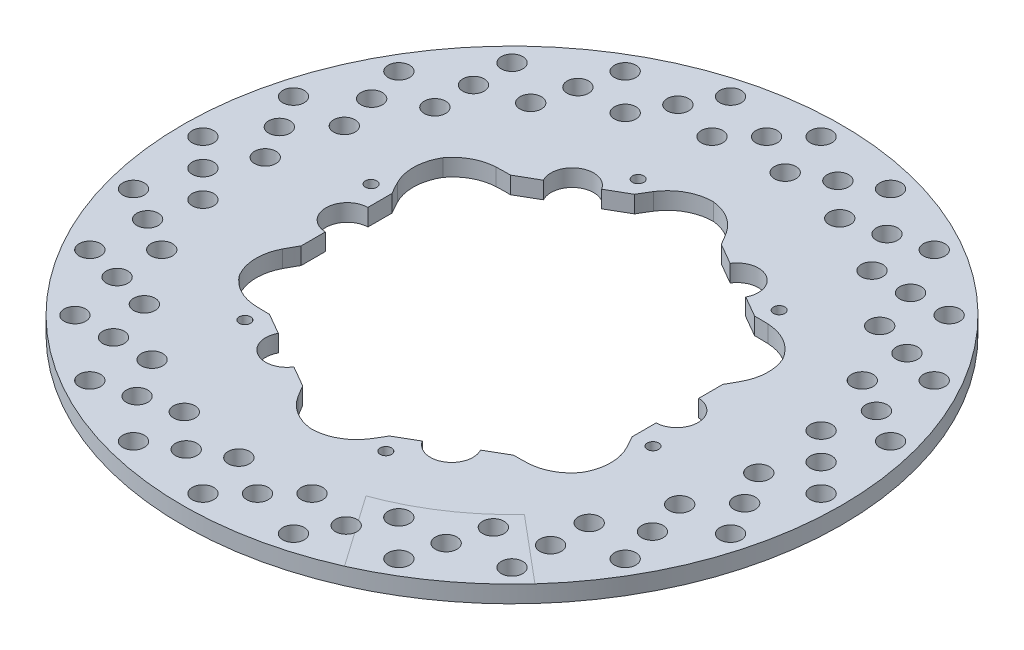
from build123d import *

# Parameters (mm, degrees)
SKETCH1_R                = 92.075
SKETCH1_R_2              = 55.5625
BOSS_EXTRUDE2_DEPTH      = 2.38125
SKETCH2_R                = 3
CUT_EXTRUDE1_DEPTH       = 131.30077765
BOSS_EXTRUDE3_DEPTH      = 2.38125
FILLET1_R                = 12.7
CIRPATTERN1_START        = -2.38125
CIRPATTERN1_DEPTH        = 4.7625
SPEED_SENSOR_HOLE_R      = 1.5875
SPEED_SENSOR_HOLES_DEPTH = 4.7625


# Read off the part's stored shape, not the designer's step: CirPattern1
with BuildPart() as part:
    # Sketch1 → Boss-Extrude2 (new, symmetric)
    with BuildSketch(Plane(origin=(0, 0, 0), x_dir=(1, 0, 0), z_dir=(0, 1, 0))):
        with Locations(Location((0, 0, 0), (0, 0, 90))):
            Circle(SKETCH1_R)
        with Locations(Location((0, 0, 0), (0, 0, 90))):
            Circle(SKETCH1_R_2, mode=Mode.SUBTRACT)
    extrude(amount=BOSS_EXTRUDE2_DEPTH, both=True)

    # Sketch2 → Cut-Extrude1 (cut, through all)
    with BuildSketch(Plane.XZ.offset(2.38125)):
        with Locations(Location((0, 86.36, 0), (0, 0, 270))):
            Circle(SKETCH2_R)
        with Locations(Location((7.62, 78.74, 0), (0, 0, 270))):
            Circle(SKETCH2_R)
        with Locations(Location((15.24, 71.12, 0), (0, 0, 270))):
            Circle(SKETCH2_R)
        with Locations(Location((27.739766408, 74.084798438, 0), (0, 0, 270))):
            Circle(SKETCH2_R)
        with Locations(Location((33.12792008, 64.752242518, 0), (0, 0, 270))):
            Circle(SKETCH2_R)
        with Locations(Location((22.351612735, 83.417354358, 0), (0, 0, 270))):
            Circle(SKETCH2_R)
        with Locations(Location((45.969113577, 64.380840294, 0), (0, 0, 270))):
            Circle(SKETCH2_R)
        with Locations(Location((48.758227154, 53.971726717, 0), (0, 0, 270))):
            Circle(SKETCH2_R)
        with Locations(Location((43.18, 74.789953871, 0), (0, 0, 270))):
            Circle(SKETCH2_R)
        with Locations(Location((61.065741623, 50.289434278, 0), (0, 0, 270))):
            Circle(SKETCH2_R)
        with Locations(Location((61.065741623, 39.513126933, 0), (0, 0, 270))):
            Circle(SKETCH2_R)
        with Locations(Location((61.065741623, 61.065741623, 0), (0, 0, 270))):
            Circle(SKETCH2_R)
        with Locations(Location((72.000840294, 32.770886423, 0), (0, 0, 270))):
            Circle(SKETCH2_R)
        with Locations(Location((69.211726717, 22.361772846, 0), (0, 0, 270))):
            Circle(SKETCH2_R)
        with Locations(Location((74.789953871, 43.18, 0), (0, 0, 270))):
            Circle(SKETCH2_R)
        with Locations(Location((78.029200686, 13.019056815, 0), (0, 0, 270))):
            Circle(SKETCH2_R)
        with Locations(Location((72.641047013, 3.686500895, 0), (0, 0, 270))):
            Circle(SKETCH2_R)
        with Locations(Location((83.417354358, 22.351612735, 0), (0, 0, 270))):
            Circle(SKETCH2_R)
        with Locations(Location((78.74, -7.62, 0), (0, 0, 270))):
            Circle(SKETCH2_R)
        with Locations(Location((71.12, -15.24, 0), (0, 0, 270))):
            Circle(SKETCH2_R)
        with Locations(Location((86.36, 0, 0), (0, 0, 270))):
            Circle(SKETCH2_R)
        with Locations(Location((74.084798438, -27.739766408, 0), (0, 0, 270))):
            Circle(SKETCH2_R)
        with Locations(Location((64.752242518, -33.12792008, 0), (0, 0, 270))):
            Circle(SKETCH2_R)
        with Locations(Location((83.417354358, -22.351612735, 0), (0, 0, 270))):
            Circle(SKETCH2_R)
        with Locations(Location((64.380840294, -45.969113577, 0), (0, 0, 270))):
            Circle(SKETCH2_R)
        with Locations(Location((53.971726717, -48.758227154, 0), (0, 0, 270))):
            Circle(SKETCH2_R)
        with Locations(Location((74.789953871, -43.18, 0), (0, 0, 270))):
            Circle(SKETCH2_R)
        with Locations(Location((50.289434278, -61.065741623, 0), (0, 0, 270))):
            Circle(SKETCH2_R)
        with Locations(Location((39.513126933, -61.065741623, 0), (0, 0, 270))):
            Circle(SKETCH2_R)
        with Locations(Location((61.065741623, -61.065741623, 0), (0, 0, 270))):
            Circle(SKETCH2_R)
        with Locations(Location((32.770886423, -72.000840294, 0), (0, 0, 270))):
            Circle(SKETCH2_R)
        with Locations(Location((22.361772846, -69.211726717, 0), (0, 0, 270))):
            Circle(SKETCH2_R)
        with Locations(Location((43.18, -74.789953871, 0), (0, 0, 270))):
            Circle(SKETCH2_R)
        with Locations(Location((13.019056815, -78.029200686, 0), (0, 0, 270))):
            Circle(SKETCH2_R)
        with Locations(Location((3.686500895, -72.641047013, 0), (0, 0, 270))):
            Circle(SKETCH2_R)
        with Locations(Location((22.351612735, -83.417354358, 0), (0, 0, 270))):
            Circle(SKETCH2_R)
        with Locations(Location((-7.62, -78.74, 0), (0, 0, 270))):
            Circle(SKETCH2_R)
        with Locations(Location((-15.24, -71.12, 0), (0, 0, 270))):
            Circle(SKETCH2_R)
        with Locations(Location((0, -86.36, 0), (0, 0, 270))):
            Circle(SKETCH2_R)
        with Locations(Location((-27.739766408, -74.084798438, 0), (0, 0, 270))):
            Circle(SKETCH2_R)
        with Locations(Location((-33.12792008, -64.752242518, 0), (0, 0, 270))):
            Circle(SKETCH2_R)
        with Locations(Location((-22.351612735, -83.417354358, 0), (0, 0, 270))):
            Circle(SKETCH2_R)
        with Locations(Location((-45.969113577, -64.380840294, 0), (0, 0, 270))):
            Circle(SKETCH2_R)
        with Locations(Location((-48.758227154, -53.971726717, 0), (0, 0, 270))):
            Circle(SKETCH2_R)
        with Locations(Location((-43.18, -74.789953871, 0), (0, 0, 270))):
            Circle(SKETCH2_R)
        with Locations(Location((-61.065741623, -50.289434278, 0), (0, 0, 270))):
            Circle(SKETCH2_R)
        with Locations(Location((-61.065741623, -39.513126933, 0), (0, 0, 270))):
            Circle(SKETCH2_R)
        with Locations(Location((-61.065741623, -61.065741623, 0), (0, 0, 270))):
            Circle(SKETCH2_R)
        with Locations(Location((-72.000840294, -32.770886423, 0), (0, 0, 270))):
            Circle(SKETCH2_R)
        with Locations(Location((-69.211726717, -22.361772846, 0), (0, 0, 270))):
            Circle(SKETCH2_R)
        with Locations(Location((-74.789953871, -43.18, 0), (0, 0, 270))):
            Circle(SKETCH2_R)
        with Locations(Location((-78.029200686, -13.019056815, 0), (0, 0, 270))):
            Circle(SKETCH2_R)
        with Locations(Location((-72.641047013, -3.686500895, 0), (0, 0, 270))):
            Circle(SKETCH2_R)
        with Locations(Location((-83.417354358, -22.351612735, 0), (0, 0, 270))):
            Circle(SKETCH2_R)
        with Locations(Location((-78.74, 7.62, 0), (0, 0, 270))):
            Circle(SKETCH2_R)
        with Locations(Location((-71.12, 15.24, 0), (0, 0, 270))):
            Circle(SKETCH2_R)
        with Locations(Location((-86.36, 0, 0), (0, 0, 270))):
            Circle(SKETCH2_R)
        with Locations(Location((-74.084798438, 27.739766408, 0), (0, 0, 270))):
            Circle(SKETCH2_R)
        with Locations(Location((-64.752242518, 33.12792008, 0), (0, 0, 270))):
            Circle(SKETCH2_R)
        with Locations(Location((-83.417354358, 22.351612735, 0), (0, 0, 270))):
            Circle(SKETCH2_R)
        with Locations(Location((-64.380840294, 45.969113577, 0), (0, 0, 270))):
            Circle(SKETCH2_R)
        with Locations(Location((-53.971726717, 48.758227154, 0), (0, 0, 270))):
            Circle(SKETCH2_R)
        with Locations(Location((-74.789953871, 43.18, 0), (0, 0, 270))):
            Circle(SKETCH2_R)
        with Locations(Location((-50.289434278, 61.065741623, 0), (0, 0, 270))):
            Circle(SKETCH2_R)
        with Locations(Location((-39.513126933, 61.065741623, 0), (0, 0, 270))):
            Circle(SKETCH2_R)
        with Locations(Location((-61.065741623, 61.065741623, 0), (0, 0, 270))):
            Circle(SKETCH2_R)
        with Locations(Location((-32.770886423, 72.000840294, 0), (0, 0, 270))):
            Circle(SKETCH2_R)
        with Locations(Location((-22.361772846, 69.211726717, 0), (0, 0, 270))):
            Circle(SKETCH2_R)
        with Locations(Location((-43.18, 74.789953871, 0), (0, 0, 270))):
            Circle(SKETCH2_R)
        with Locations(Location((-13.019056815, 78.029200686, 0), (0, 0, 270))):
            Circle(SKETCH2_R)
        with Locations(Location((-3.686500895, 72.641047013, 0), (0, 0, 270))):
            Circle(SKETCH2_R)
        with Locations(Location((-22.351612735, 83.417354358, 0), (0, 0, 270))):
            Circle(SKETCH2_R)
    extrude(amount=-CUT_EXTRUDE1_DEPTH, mode=Mode.SUBTRACT)

    # Sketch3 → Boss-Extrude3 (add, symmetric)
    with BuildSketch(Plane(origin=(0, 0, 0), x_dir=(1, 0, 0), z_dir=(0, 1, 0))):
        with BuildLine():
            Line((-46.2153, 5.950469261), (-46.2153, 12.7))
            ThreePointArc((-46.2153, 12.7), (-48.74771338, 17.374444913), (-50.92387241, 22.225))
            ThreePointArc((-50.92387241, 22.225), (-55.5625, 0), (-50.92387241, -22.225))
            ThreePointArc((-50.92387241, -22.225), (-48.74771338, -17.374444913), (-46.2153, -12.7))
            Line((-46.2153, -12.7), (-46.2153, -5.950469261))
            ThreePointArc((-46.2153, -5.950469261), (-51.990625, 0), (-46.2153, 5.950469261))
        make_face()
    extrude(amount=BOSS_EXTRUDE3_DEPTH, both=True)

    # Fillet1
    fillet1_edges = [part.edges().sort_by_distance(p)[0] for p in [
        (-50.92387241, 0, -22.225),
        (-50.92387241, 0, 22.225),
    ]]
    fillet(fillet1_edges, radius=FILLET1_R)

    # CirPattern1 outline → CirPattern1 (add)
    with BuildSketch(Plane(origin=(0, 0, 0), x_dir=(1, 0, 0), z_dir=(0, 1, 0)).offset(CIRPATTERN1_START)):
        with BuildLine():
            Line((-34.106172628, 33.673623844), (-28.260907544, 37.048389213))
            ThreePointArc((-28.260907544, 37.048389213), (-25.9953125, 45.025202009), (-17.954392456, 42.998858474))
            Line((-17.954392456, 42.998858474), (-12.109127372, 46.373623844))
            ThreePointArc((-12.109127372, 46.373623844), (-11.13754759, 48.043676571), (-10.120960404, 49.68672066))
            ThreePointArc((-10.120960404, 49.68672066), (-5.442554633, 54.035768488), (0.761209038, 55.557285454))
            ThreePointArc((0.761209038, 55.557285454), (-27.119416363, 48.494625087), (-47.73341605, 28.437869091))
            ThreePointArc((-47.73341605, 28.437869091), (-43.491476124, 32.114561986), (-38.078961632, 33.603458174))
            ThreePointArc((-38.078961632, 33.603458174), (-36.093057237, 33.666290929), (-34.106172628, 33.673623844))
        make_face()
        with BuildLine():
            ThreePointArc((-47.73341605, -28.437869091), (-27.78125, -48.118536498), (-0.761209038, -55.557285454))
            ThreePointArc((-0.761209038, -55.557285454), (-6.06628845, -53.722004164), (-10.061967618, -49.77907721))
            ThreePointArc((-10.061967618, -49.77907721), (-11.109334577, -48.090649932), (-12.109127372, -46.373623844))
            Line((-12.109127372, -46.373623844), (-17.954392456, -42.998858474))
            ThreePointArc((-17.954392456, -42.998858474), (-25.9953125, -45.025202009), (-28.260907544, -37.048389213))
            Line((-28.260907544, -37.048389213), (-34.106172628, -33.673623844))
            ThreePointArc((-34.106172628, -33.673623844), (-36.093057237, -33.666290929), (-38.078961632, -33.603458174))
            ThreePointArc((-38.078961632, -33.603458174), (-43.491476124, -32.114561986), (-47.73341605, -28.437869091))
        make_face()
        with BuildLine():
            ThreePointArc((-0.761209038, -55.557285454), (27.119416363, -48.494625088), (47.73341605, -28.437869091))
            ThreePointArc((47.73341605, -28.437869091), (43.491476124, -32.114561986), (38.078961632, -33.603458174))
            ThreePointArc((38.078961632, -33.603458174), (36.093057237, -33.666290929), (34.106172628, -33.673623844))
            Line((34.106172628, -33.673623844), (28.260907544, -37.048389213))
            ThreePointArc((28.260907544, -37.048389213), (25.9953125, -45.025202009), (17.954392456, -42.998858474))
            Line((17.954392456, -42.998858474), (12.109127372, -46.373623844))
            ThreePointArc((12.109127372, -46.373623844), (11.13754759, -48.043676571), (10.120960404, -49.68672066))
            ThreePointArc((10.120960404, -49.68672066), (5.442554633, -54.035768488), (-0.761209038, -55.557285454))
        make_face()
        with BuildLine():
            ThreePointArc((47.73341605, -28.437869091), (55.557285454, -0.761209038), (48.494625088, 27.119416363))
            ThreePointArc((48.494625088, 27.119416363), (49.557764573, 21.607442178), (48.140929249, 16.175619036))
            ThreePointArc((48.140929249, 16.175619036), (47.202391814, 14.424359003), (46.2153, 12.7))
            Line((46.2153, 12.7), (46.2153, 5.950469261))
            ThreePointArc((46.2153, 5.950469261), (51.990625, 0), (46.2153, -5.950469261))
            Line((46.2153, -5.950469261), (46.2153, -12.7))
            ThreePointArc((46.2153, -12.7), (47.175818197, -14.376439137), (48.090442525, -16.07835151))
            ThreePointArc((48.090442525, -16.07835151), (49.51762554, -22.30449367), (47.73341605, -28.437869091))
        make_face()
        with BuildLine():
            ThreePointArc((48.494625088, 27.119416363), (28.437869092, 47.73341605), (0.761209038, 55.557285454))
            ThreePointArc((0.761209038, 55.557285454), (6.06628845, 53.722004164), (10.061967618, 49.77907721))
            ThreePointArc((10.061967618, 49.77907721), (11.109334577, 48.090649932), (12.109127372, 46.373623844))
            Line((12.109127372, 46.373623844), (17.954392456, 42.998858474))
            ThreePointArc((17.954392456, 42.998858474), (25.9953125, 45.025202009), (28.260907544, 37.048389213))
            Line((28.260907544, 37.048389213), (34.106172628, 33.673623844))
            ThreePointArc((34.106172628, 33.673623844), (36.038270607, 33.667237435), (37.969482121, 33.60836915))
            ThreePointArc((37.969482121, 33.60836915), (44.075070907, 31.731274817), (48.494625088, 27.119416363))
        make_face()
    extrude(amount=CIRPATTERN1_DEPTH)

    # Speed Sensor Hole → Speed Sensor Holes (cut)
    with BuildSketch(Plane(origin=(0, 2.38125, 0), x_dir=(1, 0, 0), z_dir=(0, 1, 0))):
        with Locations(Location((-15.289554177, 50.544698403, 0), (0, 0, 270))):
            Circle(SPEED_SENSOR_HOLE_R)
        with Locations(Location((36.128215755, 38.513491531, 0), (0, 0, 270))):
            Circle(SPEED_SENSOR_HOLE_R)
        with Locations(Location((51.417769932, -12.031206872, 0), (0, 0, 270))):
            Circle(SPEED_SENSOR_HOLE_R)
        with Locations(Location((15.289554177, -50.544698403, 0), (0, 0, 270))):
            Circle(SPEED_SENSOR_HOLE_R)
        with Locations(Location((-36.128215755, -38.513491531, 0), (0, 0, 270))):
            Circle(SPEED_SENSOR_HOLE_R)
        with Locations(Location((-51.417769932, 12.031206872, 0), (0, 0, 270))):
            Circle(SPEED_SENSOR_HOLE_R)
    extrude(amount=-SPEED_SENSOR_HOLES_DEPTH, mode=Mode.SUBTRACT)


solid = part.part
